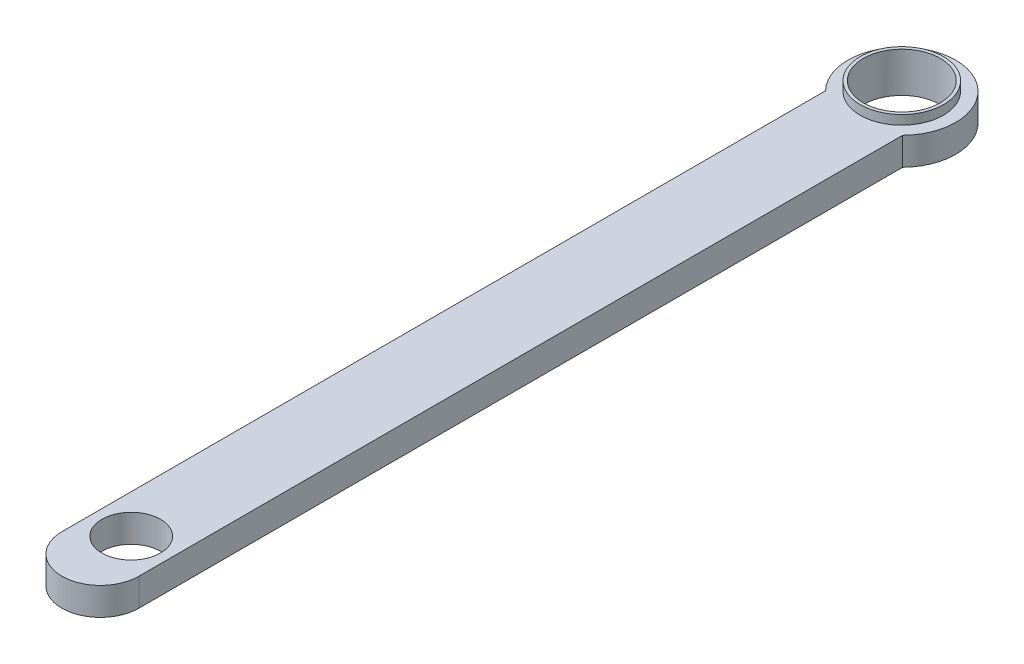
from build123d import *

# Parameters (mm, degrees)
EXTRUDE_1_DEPTH     = 9
SKETCH_2_R          = 12.5
CUT_EXTRUDE_1_DEPTH = 274.209626478
EXTRUDE_START       = 3
SKETCH_3_R          = 13.5
SKETCH_3_R_2        = 12.5
EXTRUDE_2_DEPTH     = 3
SKETCH_4_R          = 13.5
SKETCH_4_R_2        = 12.5
EXTRUDE_3_DEPTH     = 1
SKETCH_5_R          = 9.5
CUT_EXTRUDE_2_DEPTH = 274.2443961


with BuildPart() as part:
    # 스케치1 → 보스-돌출1 (new body)
    with BuildSketch(Plane(origin=(0, 0, 0), x_dir=(1, 0, 0), z_dir=(0, 1, 0))):
        with BuildLine():
            Line((-12.5, -260), (-12.5, -12.247448714))
            ThreePointArc((-12.5, -12.247448714), (0, 17.5), (12.5, -12.247448714))
            Line((12.5, -12.247448714), (12.5, -260))
            ThreePointArc((12.5, -260), (0, -272.5), (-12.5, -260))
        make_face()
    extrude(amount=EXTRUDE_1_DEPTH)

    # 스케치2 → 컷-돌출1 (cut, through all)
    with BuildSketch(Plane(origin=(0, 9, 0), x_dir=(1, 0, 0), z_dir=(0, 1, 0))):
        Circle(SKETCH_2_R)
    extrude(amount=-CUT_EXTRUDE_1_DEPTH, mode=Mode.SUBTRACT)

    # 스케치3 → 보스-돌출2 (add)
    with BuildSketch(Plane(origin=(0, 9, 0), x_dir=(1, 0, 0), z_dir=(0, 1, 0)).offset(EXTRUDE_START)):
        Circle(SKETCH_3_R)
        Circle(SKETCH_3_R_2, mode=Mode.SUBTRACT)
    extrude(amount=-EXTRUDE_2_DEPTH)

    # 스케치4 → 보스-돌출3 (add)
    with BuildSketch(Plane.XZ):
        Circle(SKETCH_4_R)
        Circle(SKETCH_4_R_2, mode=Mode.SUBTRACT)
    extrude(amount=EXTRUDE_3_DEPTH)

    # 스케치5 → 컷-돌출2 (cut, through all)
    with BuildSketch(Plane(origin=(0, 9, 0), x_dir=(1, 0, 0), z_dir=(0, 1, 0))):
        with Locations((0, -250)):
            Circle(SKETCH_5_R)
    extrude(amount=-CUT_EXTRUDE_2_DEPTH, mode=Mode.SUBTRACT)


solid = part.part
